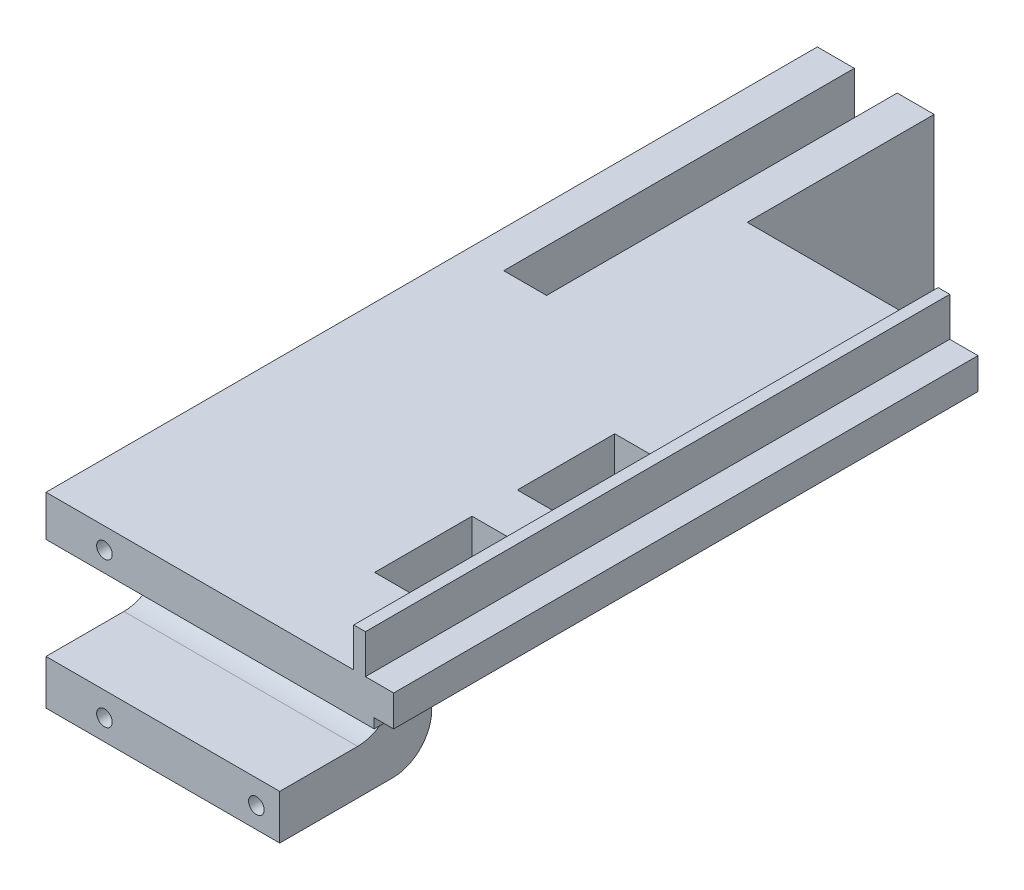
from build123d import *

# Parameters (mm, degrees)
CROQUIS1_W                 = 60
CROQUIS1_H                 = 48
SALIENTE_EXTRUIR1_DEPTH    = 6
CROQUIS4_W                 = 60
CROQUIS4_H                 = 11.5
SALIENTE_EXTRUIR3_DEPTH    = 30
CROQUIS5_R                 = 2
CORTAR_EXTRUIR3_DEPTH      = 16
CROQUIS6_W                 = 30
CROQUIS6_H                 = 48
SALIENTE_EXTRUIR4_DEPTH    = 162
CROQUIS7_R                 = 2
CORTAR_EXTRUIR4_DEPTH      = 16
CROQUIS11_W                = 150
CROQUIS11_H                = 11.5
SALIENTE_EXTRUIR6_DEPTH    = 59.25
CROQUIS12_W                = 3
CROQUIS12_H                = 150
SALIENTE_EXTRUIR7_DEPTH    = 10
CORTAR_EXTRUIR6_DEPTH      = 170.016303475
CORTAR_EXTRUIR6_DEPTH_BACK = 170.016303475
CROQUIS14_W                = 5
CROQUIS14_H                = 3.5
CORTAR_EXTRUIR7_DEPTH      = 213.768679181
CORTAR_EXTRUIR7_DEPTH_BACK = 90
CROQUIS15_W                = 11
CROQUIS15_H                = 11
CROQUIS16_W                = 30
CROQUIS16_H                = 1
CORTAR_EXTRUIR10_DEPTH     = 190.450484429
REDONDEO1_R                = 10
CROQUIS20_W                = 30
CROQUIS20_H                = 36.5
SALIENTE_EXTRUIR8_DEPTH    = 50
CROQUIS21_W                = 12
CROQUIS21_H                = 25
CORTAR_EXTRUIR11_DEPTH     = 40
CROQUIS22_W                = 30
CROQUIS22_H                = 36.5
CORTAR_EXTRUIR13_DEPTH     = 47
REDONDEO3_R                = 10
CROQUIS23_W                = 15
CROQUIS23_H                = 150
CORTAR_EXTRUIR14_DEPTH     = 10


with BuildPart() as part:
    # Croquis1 → Saliente-Extruir1 (new body)
    with BuildSketch(Plane.XY):
        with Locations((-36.216216216, 7.011261261)):
            Rectangle(CROQUIS1_W, CROQUIS1_H)
    extrude(amount=SALIENTE_EXTRUIR1_DEPTH)

    # Croquis4 → Saliente-Extruir3 (add)
    with BuildSketch(Plane.XY.offset(6)):
        with Locations((-36.216216216, 25.261261261)):
            Rectangle(CROQUIS4_W, CROQUIS4_H)
        with Locations((-36.216216216, -11.238738739)):
            Rectangle(CROQUIS4_W, CROQUIS4_H)
    extrude(amount=SALIENTE_EXTRUIR3_DEPTH)

    # Croquis5 → Cortar-Extruir3 (cut)
    with BuildSketch(Plane.XY.offset(36)):
        with Locations((-51.216216216, 25.661261261)):
            Circle(CROQUIS5_R)
        with Locations((-12.216216216, 25.661261261)):
            Circle(CROQUIS5_R)
        with Locations((-12.216216216, -11.638738739)):
            Circle(CROQUIS5_R)
        with Locations((-51.216216216, -11.638738739)):
            Circle(CROQUIS5_R)
    extrude(amount=-CORTAR_EXTRUIR3_DEPTH, mode=Mode.SUBTRACT)

    # Croquis6 → Saliente-Extruir4 (add)
    with BuildSketch(Plane(origin=(0, 0, 0), x_dir=(-1, 0, 0), z_dir=(0, 0, -1))):
        with Locations((51.216216216, 7.011261261)):
            Rectangle(CROQUIS6_W, CROQUIS6_H)
    extrude(amount=SALIENTE_EXTRUIR4_DEPTH)

    # Croquis7 → Cortar-Extruir4 (cut)
    with BuildSketch(Plane(origin=(0, 0, -162), x_dir=(-1, 0, 0), z_dir=(0, 0, -1))):
        with Locations((51.216216216, 7.011261261)):
            Circle(CROQUIS7_R)
    extrude(amount=-CORTAR_EXTRUIR4_DEPTH, mode=Mode.SUBTRACT)

    # Croquis11 → Saliente-Extruir6 (add)
    with BuildSketch(Plane(origin=(-36.216216216, 0, 0), x_dir=(0, 0, -1), z_dir=(1, 0, 0))):
        with Locations((39, 25.261261261)):
            Rectangle(CROQUIS11_W, CROQUIS11_H)
    extrude(amount=SALIENTE_EXTRUIR6_DEPTH)

    # Croquis12 → Saliente-Extruir7 (add)
    with BuildSketch(Plane(origin=(0, 31.011261261, 0), x_dir=(1, 0, 0), z_dir=(0, 1, 0))):
        with Locations((14.283783784, 39)):
            Rectangle(CROQUIS12_W, CROQUIS12_H)
    extrude(amount=SALIENTE_EXTRUIR7_DEPTH)

    # Croquis14 → Cortar-Extruir6 (cut, two sides: drawn at the far end of the back side and taken through both)
    with BuildSketch(Plane(origin=(0, 0, -114), x_dir=(-1, 0, 0), z_dir=(0, 0, -1)).offset(-CORTAR_EXTRUIR6_DEPTH_BACK)):
        with Locations((-20.533783784, 21.261261261)):
            Rectangle(CROQUIS14_W, CROQUIS14_H)
    extrude(amount=CORTAR_EXTRUIR6_DEPTH + CORTAR_EXTRUIR6_DEPTH_BACK, mode=Mode.SUBTRACT)

    # Croquis15 → Cortar-Extruir7 (cut, two sides: drawn at the far end of the back side and taken through both)
    with BuildSketch(Plane(origin=(0, 0, -162), x_dir=(-1, 0, 0), z_dir=(0, 0, -1)).offset(-CORTAR_EXTRUIR7_DEPTH_BACK)):
        with Locations((51.216216216, 25.511261261)):
            Rectangle(CROQUIS15_W, CROQUIS15_H)
    extrude(amount=CORTAR_EXTRUIR7_DEPTH + CORTAR_EXTRUIR7_DEPTH_BACK, mode=Mode.SUBTRACT)

    # Croquis16 → Cortar-Extruir10 (cut, through all)
    with BuildSketch(Plane.ZY.offset(66.216216216)):
        with Locations((21, 20.011261261)):
            Rectangle(CROQUIS16_W, CROQUIS16_H)
    extrude(amount=-CORTAR_EXTRUIR10_DEPTH, mode=Mode.SUBTRACT)

    # Redondeo1
    redondeo1_edges = [part.edges().sort_by_distance(p)[0] for p in [
        (-36.216216216, -5.488738739, 6),
        (-24.091216216, 20.511261261, 6),
    ]]
    fillet(redondeo1_edges, radius=REDONDEO1_R)

    # Croquis20 → Saliente-Extruir8 (add)
    with BuildSketch(Plane(origin=(0, 0, 0), x_dir=(-1, 0, 0), z_dir=(0, 0, -1))):
        with Locations((21.216216216, 1.261261261)):
            Rectangle(CROQUIS20_W, CROQUIS20_H)
    extrude(amount=SALIENTE_EXTRUIR8_DEPTH)

    # Croquis21 → Cortar-Extruir11 (cut)
    with BuildSketch(Plane.XZ.offset(-19.511261261)):
        with Locations((-0.216216216, -0.858898944)):
            Rectangle(CROQUIS21_W, CROQUIS21_H)
        with Locations((-0.216216216, -37.5)):
            Rectangle(CROQUIS21_W, CROQUIS21_H)
    extrude(amount=-CORTAR_EXTRUIR11_DEPTH, mode=Mode.SUBTRACT)

    # Croquis22 → Cortar-Extruir13 (cut)
    with BuildSketch(Plane(origin=(0, 0, -50), x_dir=(-1, 0, 0), z_dir=(0, 0, -1))):
        with Locations((21.216216216, 1.261261261)):
            Rectangle(CROQUIS22_W, CROQUIS22_H)
    extrude(amount=-CORTAR_EXTRUIR13_DEPTH, mode=Mode.SUBTRACT)

    # Redondeo3
    redondeo3_edges = [part.edges().sort_by_distance(p)[0] for p in [
        (-21.216216216, -16.988738739, -3),
    ]]
    fillet(redondeo3_edges, radius=REDONDEO3_R)

    # Croquis23 → Cortar-Extruir14 (cut)
    with BuildSketch(Plane.XZ.offset(16.988738739)):
        with Locations((-51.216216216, -89)):
            Rectangle(CROQUIS23_W, CROQUIS23_H)
    extrude(amount=-CORTAR_EXTRUIR14_DEPTH, mode=Mode.SUBTRACT)


solid = part.part
